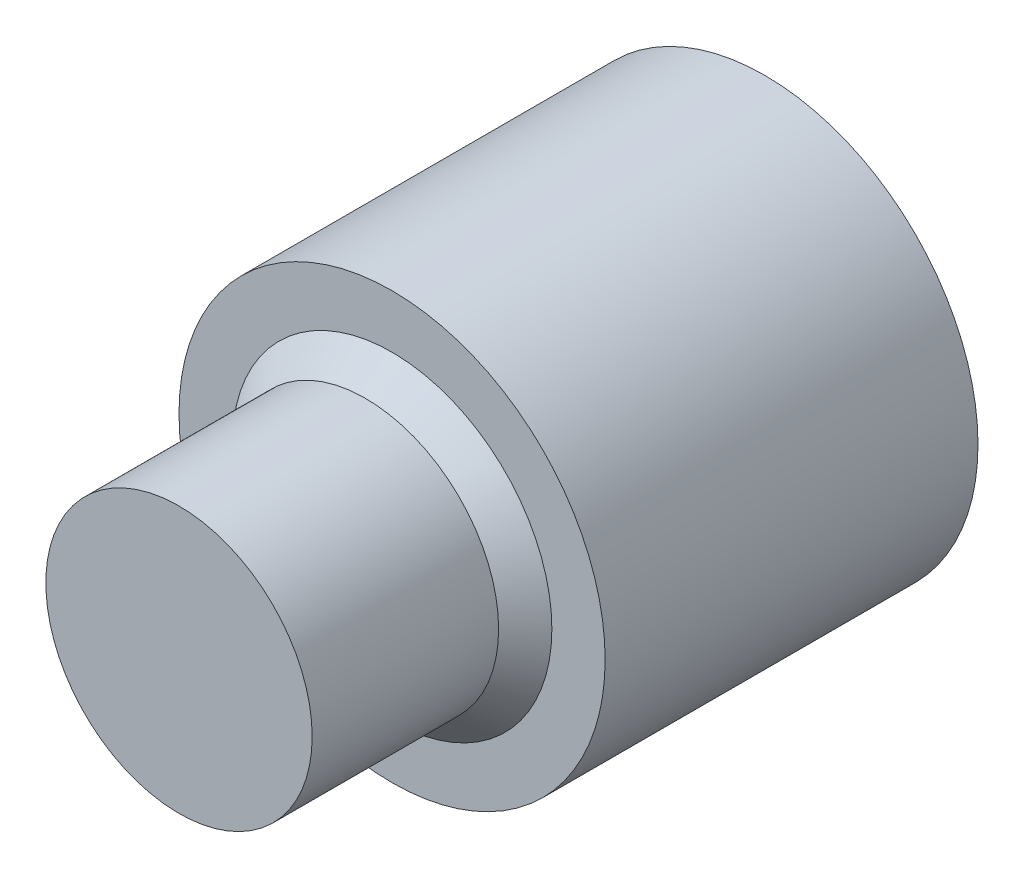
from build123d import *

# Parameters (mm, degrees)
IZIM1_R                     = 4
Y_KSEKLIK_EKSTR_ZYON1_DEPTH = 7
IZIM2_R                     = 3
Y_KSEKLIK_EKSTR_ZYON2_DEPTH = 0.5
Y_KSEKLIK_EKSTR_ZYON2_TAPER = 45
IZIM3_R                     = 2.5
Y_KSEKLIK_EKSTR_ZYON3_DEPTH = 3.5


with BuildPart() as part:
    # Çizim1 → Yükseklik-Ekstrüzyon1 (new body)
    with BuildSketch(Plane.XY):
        Circle(IZIM1_R)
    extrude(amount=Y_KSEKLIK_EKSTR_ZYON1_DEPTH)

    # Çizim2 → Yükseklik-Ekstrüzyon2 (add)
    with BuildSketch(Plane.XY.offset(7)):
        Circle(IZIM2_R)
    extrude(amount=Y_KSEKLIK_EKSTR_ZYON2_DEPTH, taper=Y_KSEKLIK_EKSTR_ZYON2_TAPER)

    # Çizim3 → Yükseklik-Ekstrüzyon3 (add)
    with BuildSketch(Plane.XY.offset(7.5)):
        Circle(IZIM3_R)
    extrude(amount=Y_KSEKLIK_EKSTR_ZYON3_DEPTH)


solid = part.part
